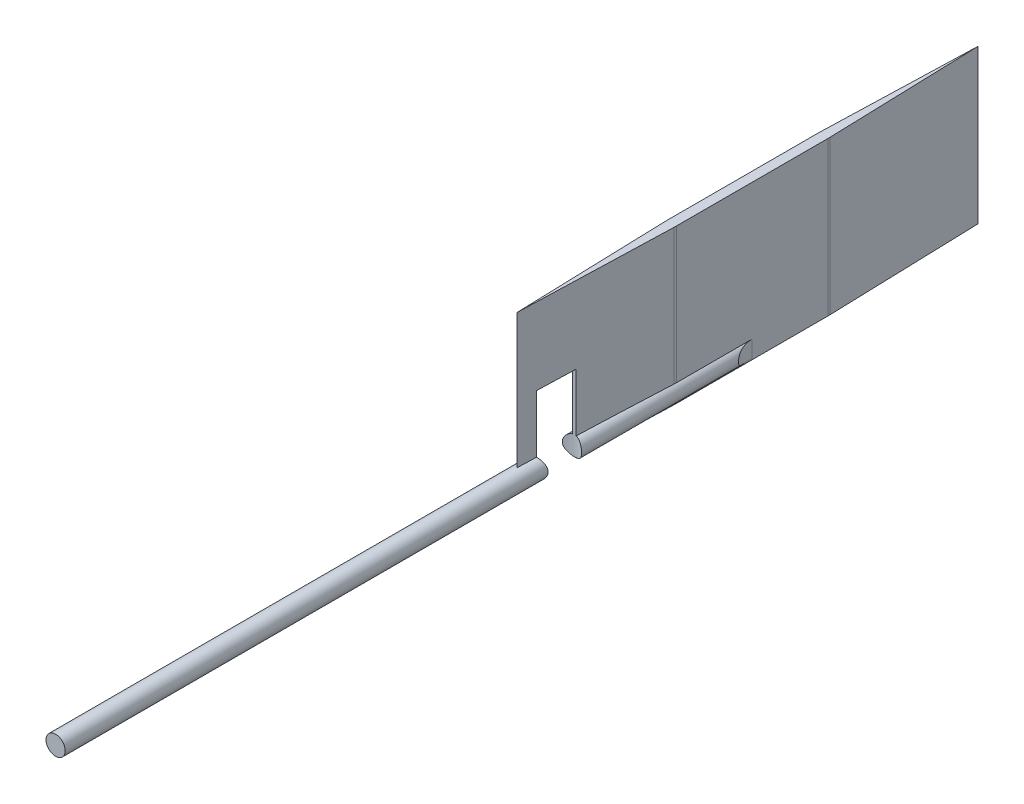
from build123d import *

# Parameters (mm, degrees)
BOSS_EXTRUDE1_DEPTH      = 25.4
FILLET1_R                = 12.7
BOSS_EXTRUDE2_DEPTH      = 76.2
BOSS_EXTRUDE2_DEPTH_BACK = 31.75
SKETCH3_R                = 1.5875
FILLET2_R                = 6.35
SKETCH4_R                = 3.175
CUT_EXTRUDE2_DEPTH       = 12.7


with BuildPart() as part:
    # Sketch1 → Boss-Extrude1 (new body)
    with BuildSketch(Plane(origin=(0, 0, 0), x_dir=(1, 0, 0), z_dir=(0, 1, 0))):
        Polygon((-0.79375, 50.8), (-0.79375, 25.4), (0, 0), (0.79375, 25.4), (0.79375, 50.8), (0, 76.2), align=None)
    extrude(amount=BOSS_EXTRUDE1_DEPTH)

    # Fillet1
    # the kernel refuses this fillet: 12.7 mm, written as the material it takes off along each edge
    with BuildSketch(Plane(origin=(-0.79375, -0.495972692, -25.4), x_dir=(0, 0, -1), z_dir=(0, 1, 0)), Plane(origin=(0.79375, -0.495972692, -50.8), x_dir=(0, 0, 1), z_dir=(0, 1, 0)), Plane(origin=(0.79375, -0.495972692, -25.4), x_dir=(-0.031234752377718417, 0, 0.9995120760870789), z_dir=(0, 1, 0))) as fillet1_piece_1:
        with BuildLine():
            CenterArc((FILLET1_R * 0.0156211871642, -FILLET1_R), FILLET1_R, 90, 1.789910608)
            Line((-FILLET1_R * 0.0156135652135, -FILLET1_R * 0.000487923912921), (0, 0))
            Line((0, 0), (FILLET1_R * 0.0156211871642, 0))
        make_face()
    extrude(amount=26.391945385, mode=Mode.SUBTRACT)
    with BuildSketch(Plane(origin=(-0.79375, -0.495972692, -50.8), x_dir=(0, 0, 1), z_dir=(0, 1, 0))) as fillet1_piece_2:
        with BuildLine():
            CenterArc((FILLET1_R * 0.0156211871642, FILLET1_R), FILLET1_R, 268.210089392, 1.789910608)
            Line((-FILLET1_R * 0.0156135652135, FILLET1_R * 0.000487923912921), (0, 0))
            Line((0, 0), (FILLET1_R * 0.0156211871642, 0))
        make_face()
    extrude(amount=26.391945385, mode=Mode.SUBTRACT)

    # Sketch3 → Boss-Extrude2 (add, two sides: drawn at the far end of the back side and taken through both)
    with BuildSketch(Plane.XY.offset(-BOSS_EXTRUDE2_DEPTH_BACK)):
        with Locations((0, 1.5875)):
            Circle(SKETCH3_R)
    extrude(amount=BOSS_EXTRUDE2_DEPTH + BOSS_EXTRUDE2_DEPTH_BACK)

    # Fillet2
    # the kernel refuses this fillet: 6.35 mm, written as the material it adds along each edge
    with BuildSketch(Plane(origin=(-0.79375, 18.837315329, -31.75), x_dir=(0, 0, -1), z_dir=(0, -1, 0))) as fillet2_piece_1_section:
        with BuildLine():
            CenterArc((FILLET2_R, -FILLET2_R), FILLET2_R, 90, 90)
            Line((0, -FILLET2_R), (0, 0))
            Line((0, 0), (FILLET2_R, 0))
        make_face()
    fillet2_piece_1 = extrude(amount=34.499630657, mode=Mode.PRIVATE)
    fillet2_piece_1 = fillet2_piece_1 & Plane(origin=(0, 1.5875, -34.046856279), x_dir=(1, 0, 0), z_dir=(0, 0, 1)) * Cylinder(1.5875, 95, mode=Mode.PRIVATE)
    add(fillet2_piece_1)
    with BuildSketch(Plane(origin=(0.79375, -15.662315329, -31.75), x_dir=(0, 0, -1), z_dir=(0, 1, 0))) as fillet2_piece_2_section:
        with BuildLine():
            CenterArc((FILLET2_R, -FILLET2_R), FILLET2_R, 90, 90)
            Line((0, -FILLET2_R), (0, 0))
            Line((0, 0), (FILLET2_R, 0))
        make_face()
    fillet2_piece_2 = extrude(amount=34.499630657, mode=Mode.PRIVATE)
    fillet2_piece_2 = fillet2_piece_2 & Plane(origin=(0, 1.5875, -34.046857324), x_dir=(1, 0, 0), z_dir=(0, 0, 1)) * Cylinder(1.5875, 95, mode=Mode.PRIVATE)
    add(fillet2_piece_2)

    # Sketch4 → Cut-Extrude2 (cut)
    with BuildSketch(Plane(origin=(0, 0, 0), x_dir=(1, 0, 0), z_dir=(0, 1, 0))):
        with Locations((0, 6.35)):
            Circle(SKETCH4_R)
    extrude(amount=CUT_EXTRUDE2_DEPTH, mode=Mode.SUBTRACT)


solid = part.part
